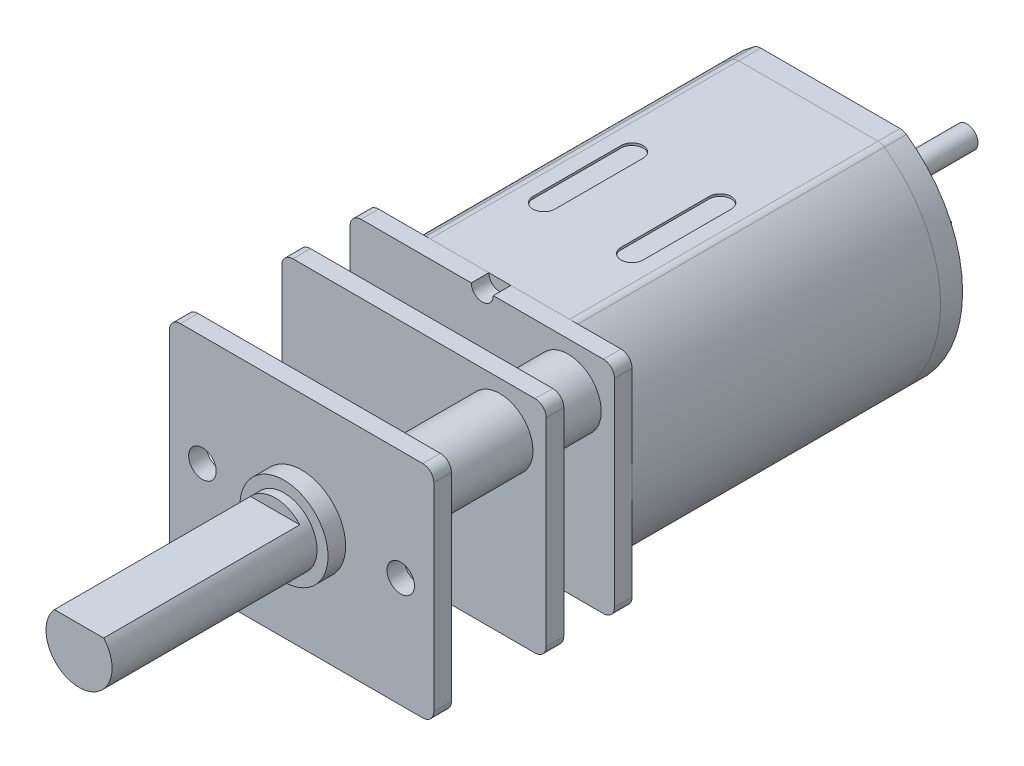
from build123d import *

# Parameters (mm, degrees)
BASE_FLANGE1_DEPTH           = 0.8
BOSS_EXTRUDE1_DEPTH          = 14
BOSS_EXTRUDE2_DEPTH          = 1
SKETCH8_R                    = 2.5
BOSS_EXTRUDE3_DEPTH          = 1
SKETCH9_R                    = 1
CUT_EXTRUDE1_DEPTH           = 0.5
SKETCH10_R                   = 0.45
BASE_FLANGE2_DEPTH           = 0.3
BASE_FLANGE3_START           = 0.8
BASE_FLANGE3_DEPTH           = 0.8
BASE_FLANGE4_DEPTH           = 0.8
SKETCH21_R                   = 1.5
BOSS_EXTRUDE4_DEPTH          = 2.3
BOSS_EXTRUDE4_2_DEPTH        = 2.3
SKETCH25_R                   = 1.5
BOSS_EXTRUDE5_DEPTH          = 4.3
BOSS_EXTRUDE5_2_DEPTH        = 4.3
SKETCH26_R                   = 2
BOSS_EXTRUDE6_DEPTH          = 0.8
SKETCH28_R                   = 1.5
BOSS_EXTRUDE7_DEPTH          = 9.3
CUT_EXTRUDE2_DEPTH           = 21.635164162
CUT_EXTRUDE2_DEPTH_BACK      = 21.635164162
SKETCH29_W                   = 8.9
SKETCH29_H                   = 0.5
M1_6_TAPPED_HOLE1_AT_2_COUNT = 2
M1_6_TAPPED_HOLE1_AT_2_PITCH = 9
SKETCH33_R                   = 0.5
CUT_EXTRUDE3_DEPTH           = 0.8
CUT_EXTRUDE4_DEPTH           = 0.1
SKETCH35_R                   = 0.5
BOSS_EXTRUDE8_DEPTH          = 5.7


# Sheet-metal steps are written as plain solids
with BuildPart() as part:
    # Sketch1 → Base-Flange1 (new body)
    with BuildSketch(Plane.XY):
        with BuildLine():
            Line((-5.5, -5), (5.5, -5))
            ThreePointArc((5.5, -5), (5.853553391, -4.853553391), (6, -4.5))
            Line((6, -4.5), (6, 4.5))
            ThreePointArc((6, 4.5), (5.853553391, 4.853553391), (5.5, 5))
            Line((5.5, 5), (-5.5, 5))
            ThreePointArc((-5.5, 5), (-5.853553391, 4.853553391), (-6, 4.5))
            Line((-6, 4.5), (-6, -4.5))
            ThreePointArc((-6, -4.5), (-5.853553391, -4.853553391), (-5.5, -5))
        make_face()
    extrude(amount=BASE_FLANGE1_DEPTH)

    # Sketch33 → Cut-Extrude3 (cut)
    with BuildSketch(Plane.XY.offset(0.8)):
        with Locations((0, 5)):
            Circle(SKETCH33_R)
    extrude(amount=-CUT_EXTRUDE3_DEPTH, mode=Mode.SUBTRACT)


with BuildPart() as body_2:
    # Sketch6 → Boss-Extrude1 (new body)
    with BuildSketch(Plane(origin=(0, 0, 0), x_dir=(-1, 0, 0), z_dir=(0, 0, -1))):
        with BuildLine():
            Line((-3.16227766, 5), (3.16227766, 5))
            ThreePointArc((3.16227766, 5), (3.313033332, 4.976731295), (3.449757447, 4.909090909))
            ThreePointArc((3.449757447, 4.909090909), (6, 0), (3.449757447, -4.909090909))
            ThreePointArc((3.449757447, -4.909090909), (3.313033332, -4.976731295), (3.16227766, -5))
            Line((3.16227766, -5), (-3.16227766, -5))
            ThreePointArc((-3.16227766, -5), (-3.313033332, -4.976731295), (-3.449757447, -4.909090909))
            ThreePointArc((-3.449757447, -4.909090909), (-6, 0), (-3.449757447, 4.909090909))
            ThreePointArc((-3.449757447, 4.909090909), (-3.313033332, 4.976731295), (-3.16227766, 5))
        make_face()
    extrude(amount=BOSS_EXTRUDE1_DEPTH)

    # Sketch34 → Cut-Extrude4 (cut)
    with BuildSketch(Plane(origin=(0, 5, 0), x_dir=(1, 0, 0), z_dir=(0, 1, 0))):
        with BuildLine():
            Line((-2.5, 4), (-2.5, 8))
            ThreePointArc((-2.5, 8), (-2, 8.5), (-1.5, 8))
            Line((-1.5, 8), (-1.5, 4))
            ThreePointArc((-1.5, 4), (-2, 3.5), (-2.5, 4))
        make_face()
        with BuildLine():
            Line((2.5, 4), (2.5, 8))
            ThreePointArc((2.5, 8), (2, 8.5), (1.5, 8))
            Line((1.5, 8), (1.5, 4))
            ThreePointArc((1.5, 4), (2, 3.5), (2.5, 4))
        make_face()
    cut_extrude4 = extrude(amount=-CUT_EXTRUDE4_DEPTH, mode=Mode.SUBTRACT)

    # Mirror2: Cut-Extrude4 across plane
    add(cut_extrude4.mirror(Plane.ZX), mode=Mode.SUBTRACT)


with BuildPart() as body_3:
    # Sketch7 → Boss-Extrude2 (new body)
    with BuildSketch(Plane(origin=(0, 0, -14), x_dir=(-1, 0, 0), z_dir=(0, 0, -1))):
        with BuildLine():
            Line((3.16227766, 5), (-3.16227766, 5))
            ThreePointArc((-3.16227766, 5), (-3.313033332, 4.976731295), (-3.449757447, 4.909090909))
            ThreePointArc((-3.449757447, 4.909090909), (-6, 0), (-3.449757447, -4.909090909))
            ThreePointArc((-3.449757447, -4.909090909), (-3.313033332, -4.976731295), (-3.16227766, -5))
            Line((-3.16227766, -5), (3.16227766, -5))
            ThreePointArc((3.16227766, -5), (3.313033332, -4.976731295), (3.449757447, -4.909090909))
            ThreePointArc((3.449757447, -4.909090909), (6, 0), (3.449757447, 4.909090909))
            ThreePointArc((3.449757447, 4.909090909), (3.313033332, 4.976731295), (3.16227766, 5))
        make_face()
    extrude(amount=BOSS_EXTRUDE2_DEPTH)

    # Sketch8 → Boss-Extrude3 (add)
    with BuildSketch(Plane(origin=(0, 0, -15), x_dir=(-1, 0, 0), z_dir=(0, 0, -1))):
        Circle(SKETCH8_R)
    extrude(amount=BOSS_EXTRUDE3_DEPTH)

    # Sketch9 → Cut-Extrude1 (cut)
    with BuildSketch(Plane(origin=(0, 0, -16), x_dir=(-1, 0, 0), z_dir=(0, 0, -1))):
        Circle(SKETCH9_R)
    extrude(amount=-CUT_EXTRUDE1_DEPTH, mode=Mode.SUBTRACT)

    # Sketch35 → Boss-Extrude8 (add)
    with BuildSketch(Plane(origin=(0, 0, -15.5), x_dir=(-1, 0, 0), z_dir=(0, 0, -1))):
        Circle(SKETCH35_R)
    extrude(amount=BOSS_EXTRUDE8_DEPTH)


with BuildPart() as body_4:
    # Sketch10 → Base-Flange2 (new body)
    with BuildSketch(Plane(origin=(3.7, 0, 0), x_dir=(0, 0, -1), z_dir=(1, 0, 0))):
        with BuildLine():
            Line((15, 0.8), (16.65, 0.8))
            ThreePointArc((16.65, 0.8), (16.756066017, 0.756066017), (16.8, 0.65))
            Line((16.8, 0.65), (16.8, -0.65))
            ThreePointArc((16.8, -0.65), (16.756066017, -0.756066017), (16.65, -0.8))
            Line((16.65, -0.8), (15, -0.8))
            Line((15, -0.8), (15, 0.8))
        make_face()
        with Locations((16, 0)):
            Circle(SKETCH10_R, mode=Mode.SUBTRACT)
    extrude(amount=-BASE_FLANGE2_DEPTH)


with BuildPart() as body_5:
    # Mirror1: mirrored copy
    add(body_4.part.mirror(Plane(origin=(0, 0, 0), x_dir=(0, 0, 1), z_dir=(1, 0, 0))))


with BuildPart() as body_6:
    # Sketch15 → Base-Flange3 (new body)
    with BuildSketch(Plane(origin=(0, 0, 9), x_dir=(-1, 0, 0), z_dir=(0, 0, -1)).offset(BASE_FLANGE3_START)):
        with BuildLine():
            Line((-5.5, -5), (5.5, -5))
            ThreePointArc((5.5, -5), (5.853553391, -4.853553391), (6, -4.5))
            Line((6, -4.5), (6, 4.5))
            ThreePointArc((6, 4.5), (5.853553391, 4.853553391), (5.5, 5))
            Line((5.5, 5), (-5.5, 5))
            ThreePointArc((-5.5, 5), (-5.853553391, 4.853553391), (-6, 4.5))
            Line((-6, 4.5), (-6, -4.5))
            ThreePointArc((-6, -4.5), (-5.853553391, -4.853553391), (-5.5, -5))
        make_face()
    extrude(amount=-BASE_FLANGE3_DEPTH)

    # Sketch26 → Boss-Extrude6 (add)
    with BuildSketch(Plane.XY.offset(9)):
        Circle(SKETCH26_R)
    extrude(amount=BOSS_EXTRUDE6_DEPTH)

    # Sketch32 → M1.6 Tapped Hole1 (revolve, cut)
    with BuildSketch(Plane(origin=(-4.5, 0, 9), x_dir=(0, -1, 0), z_dir=(1, 0, 0))):
        Polygon((0, 0), (0, 1.375537887), (0.625, 1), (0.625, 0), align=None)
    m1_6_tapped_hole1 = revolve(axis=Axis((-4.5, 0, 15.35), (0, 0, -1)), mode=Mode.SUBTRACT)

    # M1.6 Tapped Hole1 at 2: M1.6 Tapped Hole1 ×2
    with Locations(*[(i * M1_6_TAPPED_HOLE1_AT_2_PITCH, 0, 0) for i in range(1, M1_6_TAPPED_HOLE1_AT_2_COUNT)]):
        add(m1_6_tapped_hole1, mode=Mode.SUBTRACT)


with BuildPart() as body_7:
    # Sketch18 → Base-Flange4 (new body)
    with BuildSketch(Plane.XY.offset(3.1)):
        with BuildLine():
            Line((-5.5, -5), (5.5, -5))
            ThreePointArc((5.5, -5), (5.853553391, -4.853553391), (6, -4.5))
            Line((6, -4.5), (6, 4.5))
            ThreePointArc((6, 4.5), (5.853553391, 4.853553391), (5.5, 5))
            Line((5.5, 5), (-5.5, 5))
            ThreePointArc((-5.5, 5), (-5.853553391, 4.853553391), (-6, 4.5))
            Line((-6, 4.5), (-6, -4.5))
            ThreePointArc((-6, -4.5), (-5.853553391, -4.853553391), (-5.5, -5))
        make_face()
    extrude(amount=BASE_FLANGE4_DEPTH)


with BuildPart() as body_8:
    # Sketch21 → Boss-Extrude4 (new body)
    with BuildSketch(Plane.XY.offset(0.8)):
        with Locations((3.9, 2.9)):
            Circle(SKETCH21_R)
    extrude(amount=BOSS_EXTRUDE4_DEPTH)


with BuildPart() as body_9:
    # Sketch21 → Boss-Extrude4 2 (new body)
    with BuildSketch(Plane.XY.offset(0.8)):
        with Locations((-3.9, -2.9)):
            Circle(SKETCH21_R)
    extrude(amount=BOSS_EXTRUDE4_2_DEPTH)


with BuildPart() as body_10:
    # Sketch25 → Boss-Extrude5 (new body)
    with BuildSketch(Plane.XY.offset(3.9)):
        with Locations(Location((3.9, 2.9, 0), (0, 0, 180))):
            Circle(SKETCH25_R)
    extrude(amount=BOSS_EXTRUDE5_DEPTH)


with BuildPart() as body_11:
    # Sketch25 → Boss-Extrude5 2 (new body)
    with BuildSketch(Plane.XY.offset(3.9)):
        with Locations(Location((-3.9, -2.9, 0), (0, 0, 180))):
            Circle(SKETCH25_R)
    extrude(amount=BOSS_EXTRUDE5_2_DEPTH)


with BuildPart() as body_12:
    # Sketch28 → Boss-Extrude7 (new body)
    with BuildSketch(Plane.XY.offset(9.8)):
        Circle(SKETCH28_R)
    extrude(amount=BOSS_EXTRUDE7_DEPTH)

    # Sketch29 → Cut-Extrude2 (cut, two sides: drawn at the far end of the back side and taken through both)
    with BuildSketch(Plane(origin=(0, 0, 0), x_dir=(0, 0, -1), z_dir=(1, 0, 0)).offset(-CUT_EXTRUDE2_DEPTH_BACK)):
        with Locations((-14.65, 1.25)):
            Rectangle(SKETCH29_W, SKETCH29_H)
    extrude(amount=CUT_EXTRUDE2_DEPTH + CUT_EXTRUDE2_DEPTH_BACK, mode=Mode.SUBTRACT)


solid = Compound([part.part, body_2.part, body_3.part, body_4.part, body_5.part, body_6.part, body_7.part, body_8.part, body_9.part, body_10.part, body_11.part, body_12.part])
